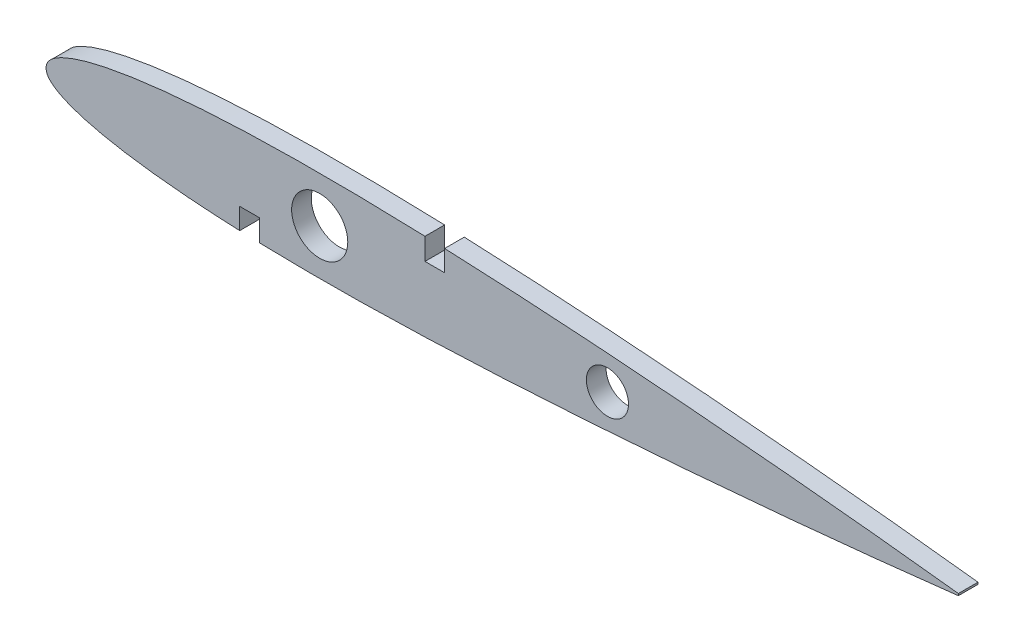
from build123d import *

# Parameters (mm, degrees)
SKETCH_1_R      = 3
SKETCH_1_R_2    = 4
EXTRUDE_1_DEPTH = 1.4


with BuildPart() as part:
    # Эскиз1 → Бобышка-Вытянуть1 (new, symmetric)
    with BuildSketch(Plane.XY):
        with BuildLine():
            Line((200, -0.1365), (200, 0.1365))
            add(Edge.make_bspline(
                [(200, 0.1365), (199.68803342, 0.172881569), (198.81669122, 0.27449757), (197.235914613, 0.456098486), (195.145010046, 0.692291497), (192.701519493, 0.962451868), (189.981579718, 1.256111468), (187.036509642, 1.566007991), (183.904963565, 1.886673282), (179.441732645, 2.330723386), (174.819068239, 2.769921708), (170.064960651, 3.20022732), (166.382173561, 3.522091337), (162.644406173, 3.836797902), (158.865943793, 4.14237985), (155.059961592, 4.437010481), (151.238665748, 4.718896441), (147.413453454, 4.986245091), (143.595021077, 5.23737347), (139.793458584, 5.470573501), (136.018308787, 5.684139375), (132.278649951, 5.876462218), (129.209784139, 6.017194243), (127.3884169, 6.092546027), (126.8, 6.115995161)],
                knots=[0, 0, 0, 0, 0.007144724, 0.019955661, 0.036196061, 0.055011184, 0.075878938, 0.098428866, 0.122375554, 0.147487885, 0.200459747, 0.22800517, 0.256076454, 0.284555151, 0.313332763, 0.342309554, 0.371392651, 0.400495752, 0.429537687, 0.458441906, 0.487136113, 0.515551917, 0.543623846, 0.557019782, 0.557019782, 0.557019782, 0.557019782], degree=3))
            Line((126.8, 6.115995161), (126.8, 3.115995161))
            Line((126.8, 3.115995161), (124, 3.115995161))
            Line((124, 3.115995161), (124, 6.220663768))
            add(Edge.make_bspline(
                [(124, 6.220663768), (123.11146317, 6.251630223), (121.050662796, 6.318359671), (117.842409031, 6.402489725), (114.402873354, 6.466317507), (111.045700994, 6.50076677), (107.777727309, 6.504988151), (104.605571578, 6.478227912), (101.535643119, 6.420092882), (98.574171232, 6.330224571), (95.72720364, 6.20862837), (93.000627425, 6.055460368), (90.400165433, 5.871109356), (87.93140692, 5.6561322), (85.599787172, 5.411383296), (83.410617303, 5.137791437), (81.369070337, 4.836509353), (79.480180392, 4.50879808), (77.748848327, 4.156021599), (76.179826925, 3.779610549), (74.777626787, 3.381064766), (73.546659786, 2.961752121), (72.490485221, 2.523001182), (71.613403941, 2.065704885), (70.914845437, 1.589483413), (70.405465138, 1.091288639), (70.065411578, 0.561470169), (70.021089193, 0.181022278), (70, 0)],
                knots=[0.578266104, 0.578266104, 0.578266104, 0.578266104, 0.59849081, 0.625169613, 0.651272029, 0.676746158, 0.701541791, 0.725611017, 0.748907835, 0.771387785, 0.793008139, 0.813728033, 0.833507815, 0.852309696, 0.87009731, 0.886835918, 0.902492782, 0.917037139, 0.930441054, 0.942679762, 0.953733567, 0.963589785, 0.972247019, 0.979722225, 0.986065145, 0.991385258, 0.995900989, 1, 1, 1, 1], degree=3))
            add(Edge.make_bspline(
                [(70, 0), (70.021089193, -0.181022278), (70.065411578, -0.561470169), (70.405465138, -1.091288639), (70.914845437, -1.589483413), (71.613403941, -2.065704885), (72.490485221, -2.523001182), (73.546659786, -2.961752121), (74.777626787, -3.381064766), (76.179826925, -3.779610549), (77.748848327, -4.156021599), (79.480180392, -4.50879808), (81.369070337, -4.836509353), (83.410617303, -5.137791437), (85.599787172, -5.411383296), (87.93140692, -5.6561322), (90.400165433, -5.871109356), (93.000627425, -6.055460368), (95.41524555, -6.191103829), (96.962536517, -6.260685275), (97.6, -6.286643263)],
                knots=[0, 0, 0, 0, 0.004099011, 0.008614742, 0.013934855, 0.020277775, 0.027752981, 0.036410215, 0.046266433, 0.057320238, 0.069558946, 0.082962861, 0.097507218, 0.113164082, 0.12990269, 0.147690304, 0.166492185, 0.186271967, 0.206991861, 0.221504823, 0.221504823, 0.221504823, 0.221504823], degree=3))
            Line((97.6, -6.286643263), (97.6, -3.286643263))
            Line((97.6, -3.286643263), (100.4, -3.286643263))
            Line((100.4, -3.286643263), (100.4, -6.38393598))
            add(Edge.make_bspline(
                [(100.4, -6.38393598), (100.766606381, -6.394566581), (102.157000483, -6.431859484), (104.605571578, -6.478227912), (107.777727309, -6.504988151), (111.045700994, -6.50076677), (114.402873354, -6.466317507), (117.842409031, -6.402489725), (121.357229156, -6.31032058), (124.940008831, -6.191027083), (128.583123626, -6.045931636), (132.278649951, -5.876462218), (136.018308787, -5.684139375), (139.793458584, -5.470573501), (143.595021077, -5.23737347), (147.413453454, -4.986245091), (151.238665748, -4.718896441), (155.059961592, -4.437010481), (158.865943793, -4.14237985), (162.644406173, -3.836797902), (166.382173561, -3.522091337), (170.064960651, -3.20022732), (174.819068239, -2.769921708), (179.441732645, -2.330723386), (183.904963565, -1.886673282), (187.036509642, -1.566007991), (189.981579718, -1.256111468), (192.701519493, -0.962451868), (195.145010046, -0.692291497), (197.235914613, -0.456098486), (198.81669122, -0.27449757), (199.68803342, -0.172881569), (200, -0.1365)],
                knots=[0.242749132, 0.242749132, 0.242749132, 0.242749132, 0.251092165, 0.274388983, 0.298458209, 0.323253842, 0.348727971, 0.374830387, 0.40150919, 0.428710016, 0.456376154, 0.484448083, 0.512863887, 0.541558094, 0.570462313, 0.599504248, 0.628607349, 0.657690446, 0.686667237, 0.715444849, 0.743923546, 0.77199483, 0.799540253, 0.852512115, 0.877624446, 0.901571134, 0.924121062, 0.944988816, 0.963803939, 0.980044339, 0.992855276, 1, 1, 1, 1], degree=3))
        make_face()
        with Locations((150, 0)):
            Circle(SKETCH_1_R, mode=Mode.SUBTRACT)
        with Locations((109, 0)):
            Circle(SKETCH_1_R_2, mode=Mode.SUBTRACT)
    extrude(amount=EXTRUDE_1_DEPTH, both=True)


solid = part.part
